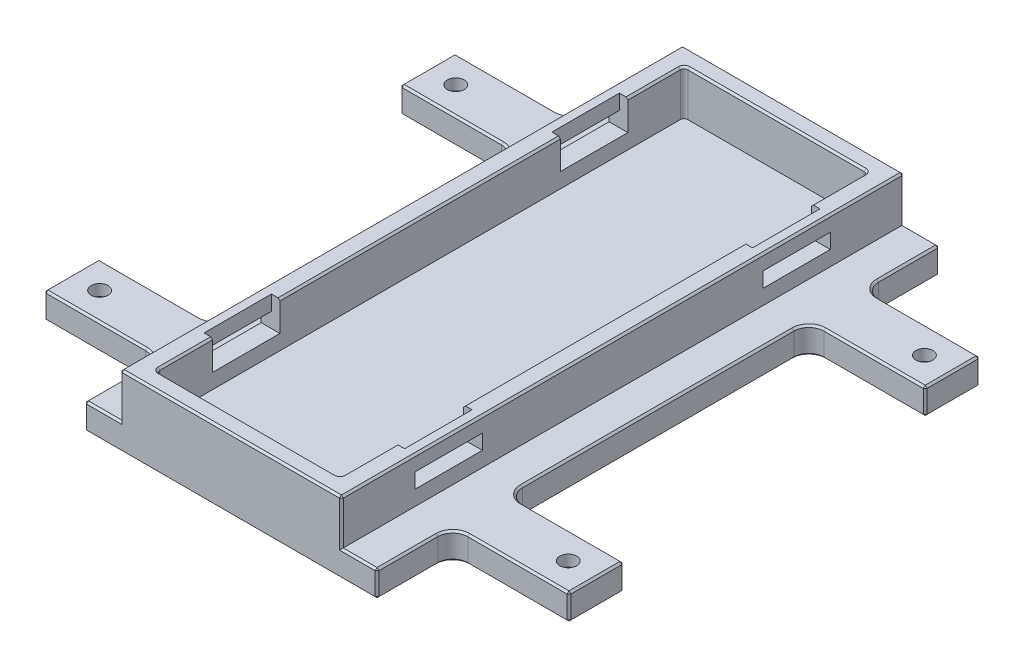
from build123d import *

# Parameters (mm, degrees)
BOSS_EXTRUDE1_DEPTH                        = 7
BOSS_EXTRUDE3_OUTLINE_W                    = 59
BOSS_EXTRUDE3_OUTLINE_H                    = 150
BOSS_EXTRUDE3_OUTLINE_W_2                  = 49
BOSS_EXTRUDE3_OUTLINE_H_2                  = 140.8
BOSS_EXTRUDE3_DEPTH                        = 12
FILLET4_R                                  = 1
SKETCH6_W                                  = 2.25
SKETCH6_H                                  = 18
CUT_EXTRUDE1_DEPTH                         = 8
SKETCH7_W                                  = 18
SKETCH7_H                                  = 4
CUT_EXTRUDE2_DEPTH                         = 124.881243536
MIRROR4_AT_THE_SECOND_PLANE_COPY_1_SKETC_W = 2.25
MIRROR4_AT_THE_SECOND_PLANE_COPY_1_SKETC_H = 18
MIRROR4_AT_THE_SECOND_PLANE_COPY_1_DEPTH   = 8
MIRROR4_AT_THE_SECOND_PLANE_COPY_2_SKETC_W = 18
MIRROR4_AT_THE_SECOND_PLANE_COPY_2_SKETC_H = 4
MIRROR4_AT_THE_SECOND_PLANE_COPY_2_DEPTH   = 124.881243536
CBORE_FOR_M4_SHCS1_D                       = 4.5
CBORE_FOR_M4_SHCS1_CBORE_D                 = 8
CBORE_FOR_M4_SHCS1_CBORE_DEPTH             = 4
SKETCH12_W                                 = 15
SKETCH12_H                                 = 80.4
SKETCH12_H_2                               = 20.2
CUT_EXTRUDE3_DEPTH                         = 10
FILLET5_R                                  = 4
CHAMFER1_SIZE                              = 0.5


# Read off the part's stored shape, not the designer's step: Boss-Extrude3
with BuildPart() as part:
    # Sketch1 → Boss-Extrude1 (new body)
    with BuildSketch(Plane(origin=(0, 0, 0), x_dir=(1, 0, 0), z_dir=(0, 1, 0))):
        Polygon((-70, 54.8), (-54, 54.8), (-54, 75), (54, 75), (54, 54.8), (70, 54.8), (70, 40.2), (54, 40.2), (54, -40.2), (70, -40.2), (70, -54.8), (54, -54.8), (54, -75), (-54, -75), (-54, -54.8), (-70, -54.8), (-70, -40.2), (-54, -40.2), (-54, 40.2), (-70, 40.2), align=None)
    extrude(amount=BOSS_EXTRUDE1_DEPTH)

    # Boss-Extrude3 outline → Boss-Extrude3 (add)
    with BuildSketch(Plane(origin=(0, 7, 0), x_dir=(1, 0, 0), z_dir=(0, 1, 0))):
        Rectangle(BOSS_EXTRUDE3_OUTLINE_W, BOSS_EXTRUDE3_OUTLINE_H)
        Rectangle(BOSS_EXTRUDE3_OUTLINE_W_2, BOSS_EXTRUDE3_OUTLINE_H_2, mode=Mode.SUBTRACT)
    extrude(amount=BOSS_EXTRUDE3_DEPTH)

    # Fillet4
    fillet4_edges = [part.edges().sort_by_distance(p)[0] for p in [
        (24.5, 13, 70.4),
        (-24.5, 13, 70.4),
        (-24.5, 13, -70.4),
        (24.5, 13, -70.4),
    ]]
    fillet(fillet4_edges, radius=FILLET4_R)

    # Sketch6 → Cut-Extrude1 (cut)
    with BuildSketch(Plane(origin=(0, 19, 0), x_dir=(1, 0, 0), z_dir=(0, 1, 0))):
        with Locations((-25.625, 46.4)):
            Rectangle(SKETCH6_W, SKETCH6_H)
    cut_extrude1 = extrude(amount=-CUT_EXTRUDE1_DEPTH, mode=Mode.SUBTRACT)

    # Sketch7 → Cut-Extrude2 (cut, through all)
    with BuildSketch(Plane(origin=(-26.75, 0, 0), x_dir=(0, 0, -1), z_dir=(1, 0, 0))):
        with Locations((46.4, 13)):
            Rectangle(SKETCH7_W, SKETCH7_H)
    cut_extrude2 = extrude(amount=-CUT_EXTRUDE2_DEPTH, mode=Mode.SUBTRACT)

    # Mirror4: Cut-Extrude1, Cut-Extrude2 across plane
    add(cut_extrude1.mirror(Plane.XY), mode=Mode.SUBTRACT)
    add(cut_extrude2.mirror(Plane.XY), mode=Mode.SUBTRACT)

    # Mirror4 at the second plane: Cut-Extrude1, Cut-Extrude2 across plane
    add(cut_extrude1.mirror(Plane(origin=(0, 0, 0), x_dir=(0, 0, 1), z_dir=(1, 0, 0))), mode=Mode.SUBTRACT)
    add(cut_extrude2.mirror(Plane(origin=(0, 0, 0), x_dir=(0, 0, 1), z_dir=(1, 0, 0))), mode=Mode.SUBTRACT)

    # Mirror4 at the second plane copy 1 sketc → Mirror4 at the second plane copy 1 (cut)
    with BuildSketch(Plane(origin=(0, 19, 0), x_dir=(-1, 0, 0), z_dir=(0, 1, 0))):
        with Locations((-25.625, 46.4)):
            Rectangle(MIRROR4_AT_THE_SECOND_PLANE_COPY_1_SKETC_W, MIRROR4_AT_THE_SECOND_PLANE_COPY_1_SKETC_H)
    extrude(amount=-MIRROR4_AT_THE_SECOND_PLANE_COPY_1_DEPTH, mode=Mode.SUBTRACT)

    # Mirror4 at the second plane copy 2 sketc → Mirror4 at the second plane copy 2 (cut, through all)
    with BuildSketch(Plane.ZY.offset(-26.75)):
        with Locations((46.4, 13)):
            Rectangle(MIRROR4_AT_THE_SECOND_PLANE_COPY_2_SKETC_W, MIRROR4_AT_THE_SECOND_PLANE_COPY_2_SKETC_H)
    extrude(amount=-MIRROR4_AT_THE_SECOND_PLANE_COPY_2_DEPTH, mode=Mode.SUBTRACT)

    # CBORE for M4 SHCS1 (through all)
    with Locations(Plane(origin=(0, 0, 0), x_dir=(-1, 0, 0), z_dir=(0, -1, 0))):
        with Locations((-62.5, 47.5), (62.5, 47.5), (62.5, -47.5), (-62.5, -47.5)):
            CounterBoreHole(CBORE_FOR_M4_SHCS1_D / 2, CBORE_FOR_M4_SHCS1_CBORE_D / 2, CBORE_FOR_M4_SHCS1_CBORE_DEPTH)

    # Sketch12 → Cut-Extrude3 (cut)
    with BuildSketch(Plane(origin=(0, 7, 0), x_dir=(1, 0, 0), z_dir=(0, 1, 0))):
        with Locations((-46.5, 0)):
            Rectangle(SKETCH12_W, SKETCH12_H)
        with Locations((46.5, 0)):
            Rectangle(SKETCH12_W, SKETCH12_H)
        with Locations((-46.5, 64.9)):
            Rectangle(SKETCH12_W, SKETCH12_H_2)
        with Locations((-46.5, -64.9)):
            Rectangle(SKETCH12_W, SKETCH12_H_2)
        with Locations((46.5, -64.9)):
            Rectangle(SKETCH12_W, SKETCH12_H_2)
        with Locations((46.5, 64.9)):
            Rectangle(SKETCH12_W, SKETCH12_H_2)
    extrude(amount=-CUT_EXTRUDE3_DEPTH, mode=Mode.SUBTRACT)

    # Fillet5
    fillet5_edges = [part.edges().sort_by_distance(p)[0] for p in [
        (39, 3.5, 40.2),
        (39, 3.5, -40.2),
        (-39, 3.5, -54.8),
        (-39, 3.5, 54.8),
        (39, 3.5, 54.8),
        (39, 3.5, -54.8),
        (-39, 3.5, -40.2),
        (-39, 3.5, 40.2),
    ]]
    fillet(fillet5_edges, radius=FILLET5_R)

    # Chamfer1
    chamfer1_edges = [part.edges().sort_by_distance(p)[0] for p in [
        (70, 7, 47.5),
        (-24.5, 19, 62.4),
        (56.5, 7, -40.2),
        (0, 19, 70.4),
        (70, 7, -47.5),
        (24.5, 19, 62.4),
        (0, 19, -70.4),
        (-24.207106781, 19, 70.107106781),
        (24.207106781, 19, 70.107106781),
        (24.207106781, 19, -70.107106781),
        (-24.207106781, 19, -70.107106781),
        (-24.5, 19, -62.4),
        (24.5, 19, -62.4),
        (-24.5, 19, 0),
        (24.5, 19, 0),
        (70, 0, -47.5),
        (56.5, 0, -40.2),
        (70, 0, 47.5),
        (56.5, 0, 54.8),
        (-56.5, 0, 54.8),
        (34.25, 7, 75),
        (34.25, 7, -75),
        (-70, 0, 47.5),
        (0, 0, 75),
        (0, 0, -75),
        (-39, 0, 66.9),
        (-70, 0, -47.5),
        (-56.5, 0, -54.8),
        (-39, 3.5, -75),
        (-39, 3.5, 75),
        (-39, 7, 66.9),
        (39, 3.5, 75),
        (39, 0, -66.9),
        (39, 3.5, -75),
        (39, 7, -66.9),
        (56.5, 0, -54.8),
        (56.5, 7, -54.8),
        (39, 7, 0),
        (39, 0, 0),
        (56.5, 0, 40.2),
        (56.5, 7, 40.2),
        (39, 7, 66.9),
        (39, 0, 66.9),
        (-39, 7, 0),
        (-39, 0, 0),
        (-56.5, 0, 40.2),
        (-56.5, 7, 40.2),
        (-39, 7, -66.9),
        (-39, 0, -66.9),
        (-56.5, 0, -40.2),
        (-56.5, 7, -40.2),
        (40.171572875, 7, -55.971572875),
        (40.171572875, 0, -55.971572875),
        (40.171572875, 7, -39.028427125),
        (40.171572875, 0, -39.028427125),
        (40.171572875, 7, 39.028427125),
        (40.171572875, 0, 39.028427125),
        (40.171572875, 7, 55.971572875),
        (40.171572875, 0, 55.971572875),
        (-40.171572875, 7, 55.971572875),
        (-40.171572875, 0, 55.971572875),
        (-40.171572875, 7, 39.028427125),
        (-40.171572875, 0, 39.028427125),
        (-40.171572875, 7, -55.971572875),
        (-40.171572875, 0, -55.971572875),
        (-40.171572875, 7, -39.028427125),
        (-40.171572875, 0, -39.028427125),
        (70, 3.5, -54.8),
        (70, 3.5, -40.2),
        (70, 3.5, 40.2),
        (70, 3.5, 54.8),
        (-70, 3.5, 54.8),
        (-70, 3.5, 40.2),
        (-56.5, 7, -54.8),
        (-70, 3.5, -40.2),
        (-70, 3.5, -54.8),
        (-70, 7, -47.5),
        (-70, 7, 47.5),
        (-56.5, 7, 54.8),
        (-34.25, 7, -75),
        (-34.25, 7, 75),
        (-29.5, 19, 0),
        (-29.5, 13, -75),
        (-29.5, 13, 75),
        (29.5, 13, 75),
        (29.5, 13, -75),
        (0, 19, 75),
        (29.5, 19, 0),
        (56.5, 7, 54.8),
        (0, 19, -75),
    ]]
    chamfer(chamfer1_edges, length=CHAMFER1_SIZE)


solid = part.part
